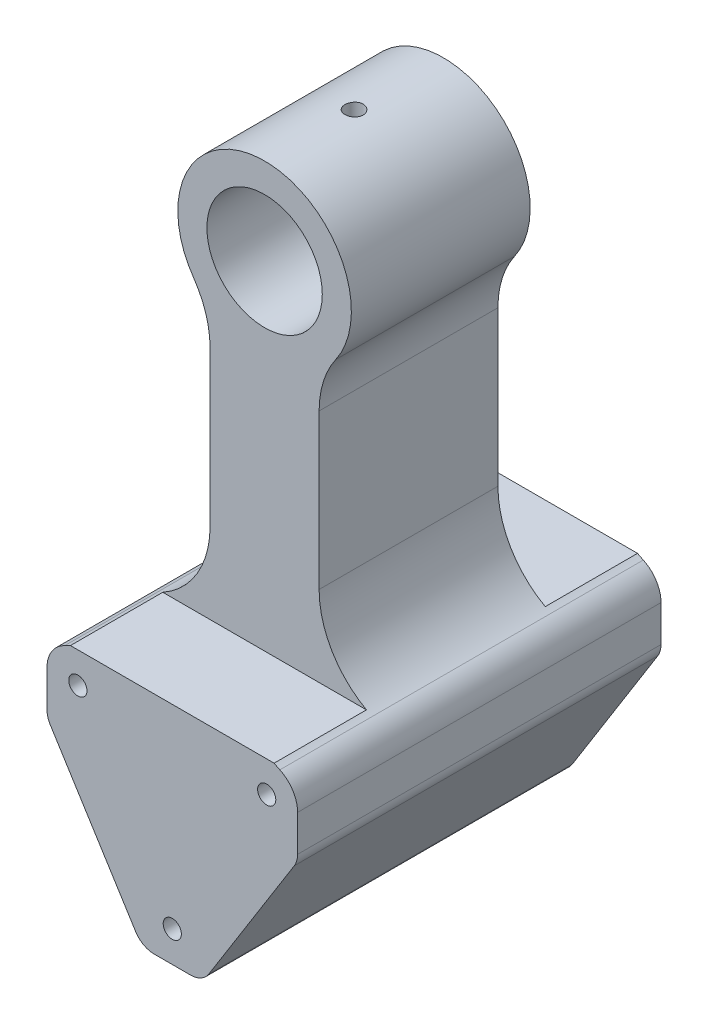
from build123d import *

# Parameters (mm, degrees)
BOSS_EXTRUDE1_DEPTH = 25
SKETCH1_3_R         = 7.9375
BOSS_EXTRUDE2_DEPTH = 12.3
SKETCH3_R           = 1.25
CUT_EXTRUDE1_DEPTH  = 84.203236869
SKETCH4_R           = 1.25
CUT_EXTRUDE2_DEPTH  = 10


with BuildPart() as part:
    # Sketch1 → Boss-Extrude1 (new, symmetric)
    with BuildSketch(Plane.XY):
        with BuildLine():
            Line((14.011631608, -46.463203436), (-14.011631608, -46.463203436))
            ThreePointArc((-14.011631608, -46.463203436), (-14.401354266, -46.671858143), (-14.798102621, -46.866822962))
            ThreePointArc((-14.798102621, -46.866822962), (-16.578229761, -48.435081034), (-17.240381057, -50.713203436))
            Line((-17.240381057, -50.713203436), (-17.240381057, -55.713203436))
            ThreePointArc((-17.240381057, -55.713203436), (-17.123784168, -56.541446455), (-16.783056724, -57.305309102))
            Line((-16.783056724, -57.305309102), (-5.042675667, -76.055309102))
            ThreePointArc((-5.042675667, -76.055309102), (-3.953217637, -77.087733584), (-2.5, -77.463203436))
            Line((-2.5, -77.463203436), (2.5, -77.463203436))
            ThreePointArc((2.5, -77.463203436), (3.953217637, -77.087733584), (5.042675667, -76.055309102))
            Line((5.042675667, -76.055309102), (16.783056724, -57.305309102))
            ThreePointArc((16.783056724, -57.305309102), (17.123784168, -56.541446455), (17.240381057, -55.713203436))
            Line((17.240381057, -55.713203436), (17.240381057, -50.713203436))
            ThreePointArc((17.240381057, -50.713203436), (16.578229761, -48.435081034), (14.798102621, -46.866822962))
            ThreePointArc((14.798102621, -46.866822962), (14.401354266, -46.671858143), (14.011631608, -46.463203436))
        make_face()
    extrude(amount=BOSS_EXTRUDE1_DEPTH, both=True)

    # Sketch1<3> → Boss-Extrude2 (add, symmetric)
    with BuildSketch(Plane.XY):
        with BuildLine():
            ThreePointArc((-7.5, -35.372933076), (-9.248235791, -41.803241056), (-14.011631608, -46.463203436))
            Line((-14.011631608, -46.463203436), (14.011631608, -46.463203436))
            ThreePointArc((14.011631608, -46.463203436), (9.248235791, -41.803241056), (7.5, -35.372933076))
            Line((7.5, -35.372933076), (7.5, -14.105545231))
            ThreePointArc((7.5, -14.105545231), (8.085343648, -10.294364118), (9.787417555, -6.83449807))
            ThreePointArc((9.787417555, -6.83449807), (0, 11.9375), (-9.787417555, -6.83449807))
            ThreePointArc((-9.787417555, -6.83449807), (-8.085343648, -10.294364118), (-7.5, -14.105545231))
            Line((-7.5, -14.105545231), (-7.5, -35.372933076))
        make_face()
        Circle(SKETCH1_3_R, mode=Mode.SUBTRACT)
    extrude(amount=BOSS_EXTRUDE2_DEPTH, both=True)

    # Sketch3 → Cut-Extrude1 (cut, through all)
    with BuildSketch(Plane(origin=(0, 0, 0), x_dir=(1, 0, 0), z_dir=(0, 1, 0))):
        Circle(SKETCH3_R)
    extrude(amount=CUT_EXTRUDE1_DEPTH, mode=Mode.SUBTRACT)

    # Sketch4 → Cut-Extrude2 (cut)
    with BuildSketch(Plane.XY.offset(25)):
        with Locations((-12.990381057, -50.713203436)):
            Circle(SKETCH4_R)
        with Locations((12.990381057, -50.713203436)):
            Circle(SKETCH4_R)
        with Locations((0, -73.213203436)):
            Circle(SKETCH4_R)
    cut_extrude2 = extrude(amount=-CUT_EXTRUDE2_DEPTH, mode=Mode.SUBTRACT)

    # Mirror1: Cut-Extrude2 across plane
    add(cut_extrude2.mirror(Plane.XY), mode=Mode.SUBTRACT)


solid = part.part
